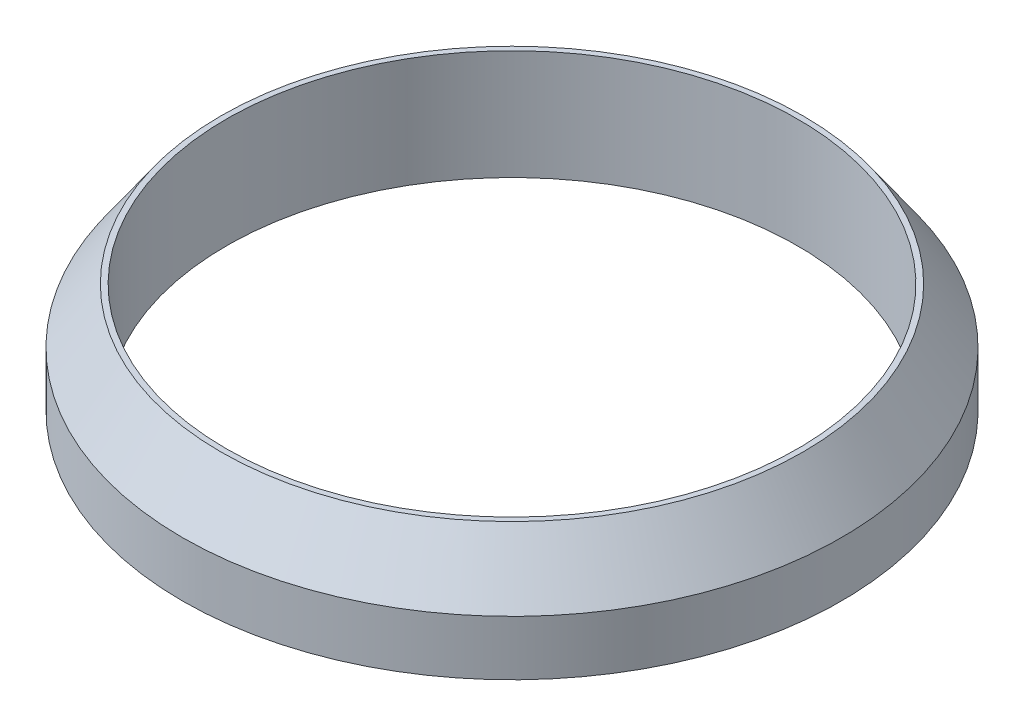
from build123d import *

# Parameters (mm, degrees)
SKETCH2_R           = 76.2
SKETCH2_R_2         = 66.04
BOSS_EXTRUDE1_DEPTH = 25.4


with BuildPart() as part:
    # Sketch2 → Boss-Extrude1 (new body)
    with BuildSketch(Plane(origin=(0, 0, 0), x_dir=(1, 0, 0), z_dir=(0, 1, 0))):
        Circle(SKETCH2_R)
        Circle(SKETCH2_R_2, mode=Mode.SUBTRACT)
    extrude(amount=BOSS_EXTRUDE1_DEPTH)

    # Sketch5 → Cut-Revolve2 (revolve, cut)
    with BuildSketch(Plane(origin=(0, 0, 0), x_dir=(0, 0, -1), z_dir=(1, 0, 0))):
        Polygon((-76.2, 12.7), (-67.31, 25.4), (-76.2, 25.4), align=None)
    revolve(axis=Axis((0, 0, 0), (0, 1, 0)), mode=Mode.SUBTRACT)


solid = part.part
